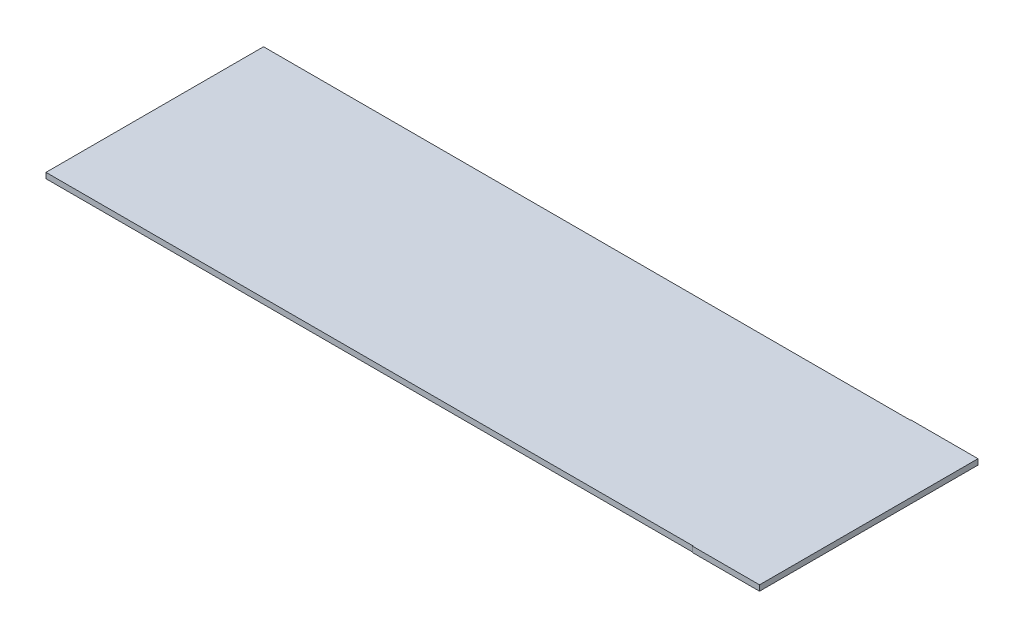
from build123d import *

# Parameters (mm, degrees)
BOSS_EXTRUDE1_DEPTH = 1.5875


with BuildPart() as part:
    # Sketch1 → Boss-Extrude1 (new, symmetric)
    with BuildSketch(Plane(origin=(0, 0, 0), x_dir=(1, 0, 0), z_dir=(0, 1, 0))):
        Polygon((203.2, 62.1792), (165.1, 62.1792), (165.1, 61.9125), (-203.2, 61.9125), (-203.2, -61.9125), (165.1, -61.9125), (165.1, -62.1792), (203.2, -62.1792), align=None)
    extrude(amount=BOSS_EXTRUDE1_DEPTH, both=True)


solid = part.part
